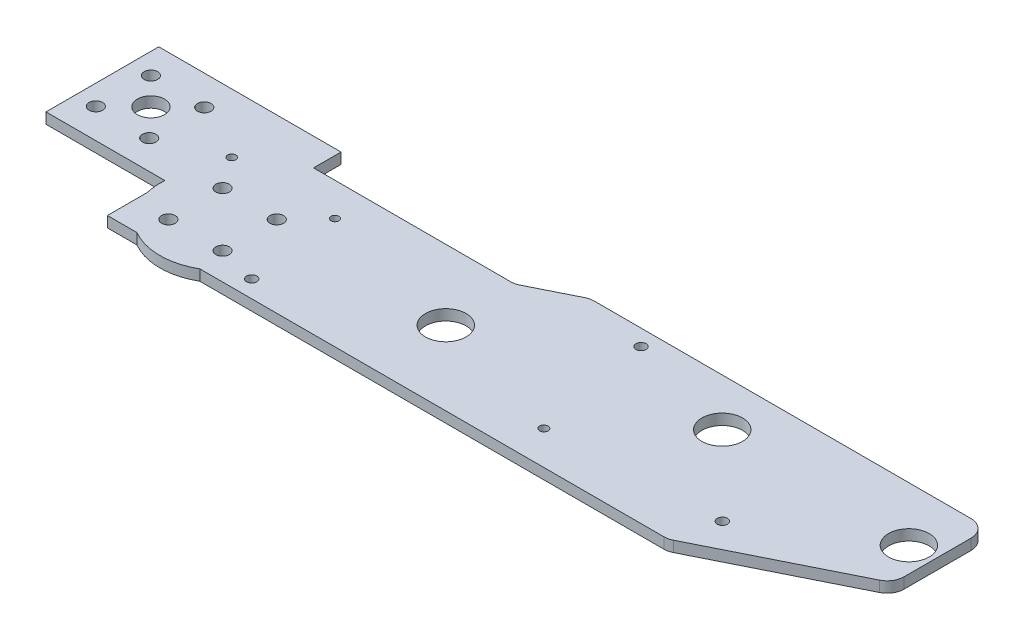
from build123d import *

# Parameters (mm, degrees)
SKETCH1_W           = 210
SKETCH1_H           = 50
SKETCH1_R           = 1.211665018
SKETCH1_R_2         = 1.165617118
SKETCH1_R_3         = 1.5
SKETCH1_R_4         = 1.25
SKETCH1_R_5         = 1.517273905
BOSS_EXTRUDE1_DEPTH = 3.175
SKETCH2_R           = 2
CUT_EXTRUDE1_DEPTH  = 10
SKETCH3_R           = 6
SKETCH3_R_2         = 0.586995366
CUT_EXTRUDE2_DEPTH  = 57.15
CUT_EXTRUDE7_DEPTH  = 10
FILLET3_R           = 5
SKETCH11_R          = 18.5
SKETCH11_R_2        = 2
BOSS_EXTRUDE4_DEPTH = 3.175
SKETCH16_W          = 18.257640281
SKETCH16_H          = 3.175
BOSS_EXTRUDE7_DEPTH = 8.128
SKETCH17_W          = 33.3
SKETCH17_H          = 3.175
BOSS_EXTRUDE8_DEPTH = 35.56
SKETCH18_R          = 2
CUT_EXTRUDE8_DEPTH  = 9
SKETCH19_R          = 4
CUT_EXTRUDE9_DEPTH  = 40


with BuildPart() as part:
    # Sketch1 → Boss-Extrude1 (new body)
    with BuildSketch(Plane(origin=(0, 0, 0), x_dir=(1, 0, 0), z_dir=(0, 1, 0))):
        with Locations((105, -25)):
            Rectangle(SKETCH1_W, SKETCH1_H)
        with Locations((3.489526233, -16.787661112)):
            Circle(SKETCH1_R, mode=Mode.SUBTRACT)
        with Locations((34.37258772, -17.194005245)):
            Circle(SKETCH1_R_2, mode=Mode.SUBTRACT)
        with Locations((37.520749958, -44.921198121)):
            Circle(SKETCH1_R_3, mode=Mode.SUBTRACT)
        with Locations((118.879039361, -40.017685043)):
            Circle(SKETCH1_R_4, mode=Mode.SUBTRACT)
        with Locations((112.302052499, -4.739260115)):
            Circle(SKETCH1_R_3, mode=Mode.SUBTRACT)
        with Locations((168.975233936, -37.403209633)):
            Circle(SKETCH1_R_5, mode=Mode.SUBTRACT)
    extrude(amount=BOSS_EXTRUDE1_DEPTH)

    # Sketch2 → Cut-Extrude1 (cut)
    with BuildSketch(Plane(origin=(0, 3.175, 0), x_dir=(1, 0, 0), z_dir=(0, 1, 0))):
        with Locations((10, -26)):
            Circle(SKETCH2_R)
        with Locations((10, -42)):
            Circle(SKETCH2_R)
        with Locations((26, -26)):
            Circle(SKETCH2_R)
        with Locations((26, -42)):
            Circle(SKETCH2_R)
    extrude(amount=-CUT_EXTRUDE1_DEPTH, mode=Mode.SUBTRACT)

    # Sketch3 → Cut-Extrude2 (cut)
    with BuildSketch(Plane(origin=(0, 3.175, 0), x_dir=(1, 0, 0), z_dir=(0, 1, 0))):
        with Locations((78.01026379, -28.1)):
            Circle(SKETCH3_R)
        with Locations((145.531297368, -14)):
            Circle(SKETCH3_R)
        with Locations((18, -34)):
            Circle(SKETCH3_R_2)
        with Locations((202.646291021, -16)):
            Circle(SKETCH3_R)
    extrude(amount=-CUT_EXTRUDE2_DEPTH, mode=Mode.SUBTRACT)

    # Sketch10 → Cut-Extrude7 (cut)
    with BuildSketch(Plane(origin=(0, 3.175, 0), x_dir=(1, 0, 0), z_dir=(0, 1, 0))):
        Polygon((210, -27.859435908), (165.502877994, -50), (210, -50), align=None)
        Polygon((92.532613397, 0), (77.65477062, -7.402812063), (0, -7.402812063), (0, 0), align=None)
    extrude(amount=-CUT_EXTRUDE7_DEPTH, mode=Mode.SUBTRACT)

    # Fillet3
    fillet3_edges = [part.edges().sort_by_distance(p)[0] for p in [
        (77.65477062, 1.5875, 7.402812063),
        (92.532613397, 1.5875, 0),
        (210, 1.5875, 0),
        (210, 1.5875, 27.859435908),
        (165.502877994, 1.5875, 50),
    ]]
    fillet(fillet3_edges, radius=FILLET3_R)

    # Sketch11 → Boss-Extrude4 (add)
    with BuildSketch(Plane(origin=(0, 3.175, 0), x_dir=(1, 0, 0), z_dir=(0, 1, 0))):
        with Locations((18, -34)):
            Circle(SKETCH11_R)
        with Locations((10, -26)):
            Circle(SKETCH11_R_2, mode=Mode.SUBTRACT)
        with Locations((10, -42)):
            Circle(SKETCH11_R_2, mode=Mode.SUBTRACT)
        with Locations((26, -26)):
            Circle(SKETCH11_R_2, mode=Mode.SUBTRACT)
        with Locations((26, -42)):
            Circle(SKETCH11_R_2, mode=Mode.SUBTRACT)
    extrude(amount=-BOSS_EXTRUDE4_DEPTH)

    # Sketch16 → Boss-Extrude7 (add)
    with BuildSketch(Plane(origin=(0, 0, 7.402812063), x_dir=(-1, 0, 0), z_dir=(0, 0, -1))):
        with Locations((-9.128820141, 1.5875)):
            Rectangle(SKETCH16_W, SKETCH16_H)
    extrude(amount=BOSS_EXTRUDE7_DEPTH)

    # Sketch17 → Boss-Extrude8 (add)
    with BuildSketch(Plane.ZY):
        with Locations((15.924812063, 1.5875)):
            Rectangle(SKETCH17_W, SKETCH17_H)
    extrude(amount=BOSS_EXTRUDE8_DEPTH)

    # Sketch18 → Cut-Extrude8 (cut)
    with BuildSketch(Plane(origin=(0, 3.175, 0), x_dir=(1, 0, 0), z_dir=(0, 1, 0))):
        with Locations((-29.612034681, -23.798543698)):
            Circle(SKETCH18_R)
        with Locations((-29.359661767, -7.798707515)):
            Circle(SKETCH18_R)
        with Locations((-13.359825583, -8.051080428)):
            Circle(SKETCH18_R)
        with Locations((-13.612198497, -24.050916612)):
            Circle(SKETCH18_R)
    extrude(amount=-CUT_EXTRUDE8_DEPTH, mode=Mode.SUBTRACT)

    # Sketch19 → Cut-Extrude9 (cut)
    with BuildSketch(Plane(origin=(0, 3.175, 0), x_dir=(1, 0, 0), z_dir=(0, 1, 0))):
        with Locations((-21.359661767, -15.798707515)):
            Circle(SKETCH19_R)
    extrude(amount=-CUT_EXTRUDE9_DEPTH, mode=Mode.SUBTRACT)


solid = part.part
